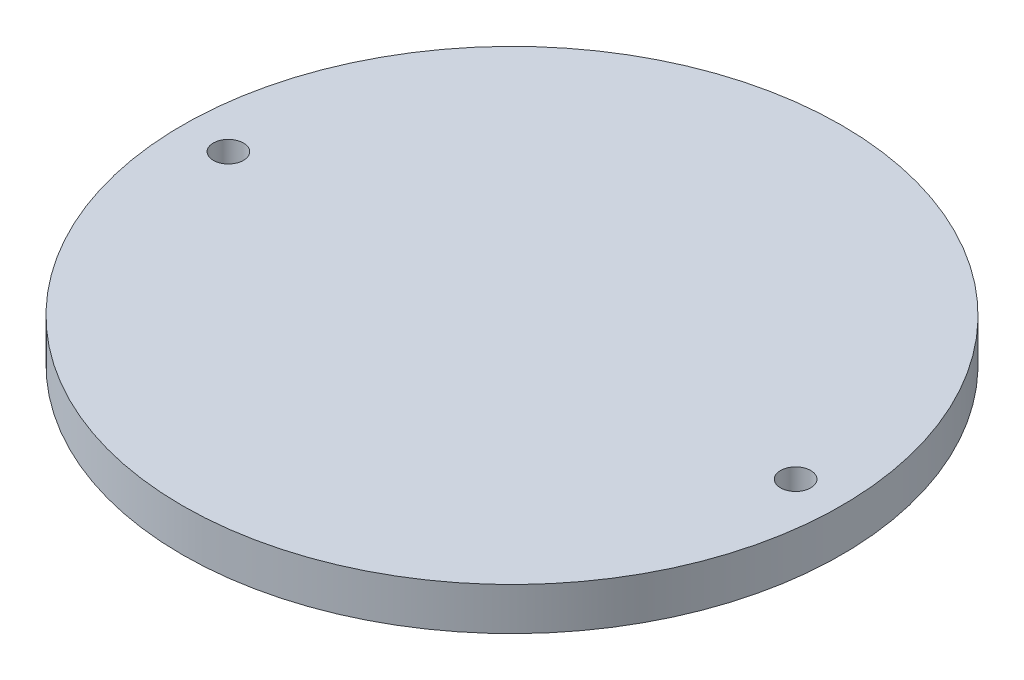
from build123d import *

# Parameters (mm, degrees)
PAYLOAD_COVER_PROFILE_R      = 73.787
PAYLOAD_COVER_BODY_DEPTH     = 9.525
THREADED_ROD_HOLE_PROFILES_R = 3.3782
THREADED_ROD_HOLE_CUTS_DEPTH = 105.784389882


with BuildPart() as part:
    # Payload Cover Profile → Payload Cover Body (new body)
    with BuildSketch(Plane(origin=(0, 0, 0), x_dir=(1, 0, 0), z_dir=(0, 1, 0))):
        Circle(PAYLOAD_COVER_PROFILE_R)
    extrude(amount=PAYLOAD_COVER_BODY_DEPTH)

    # Threaded Rod Hole Profiles → Threaded Rod Hole Cuts (cut, through all)
    with BuildSketch(Plane(origin=(0, 9.525, 0), x_dir=(1, 0, 0), z_dir=(0, 1, 0))):
        with Locations((-63.5, 0)):
            Circle(THREADED_ROD_HOLE_PROFILES_R)
        with Locations((63.5, 0)):
            Circle(THREADED_ROD_HOLE_PROFILES_R)
    extrude(amount=-THREADED_ROD_HOLE_CUTS_DEPTH, mode=Mode.SUBTRACT)


solid = part.part
